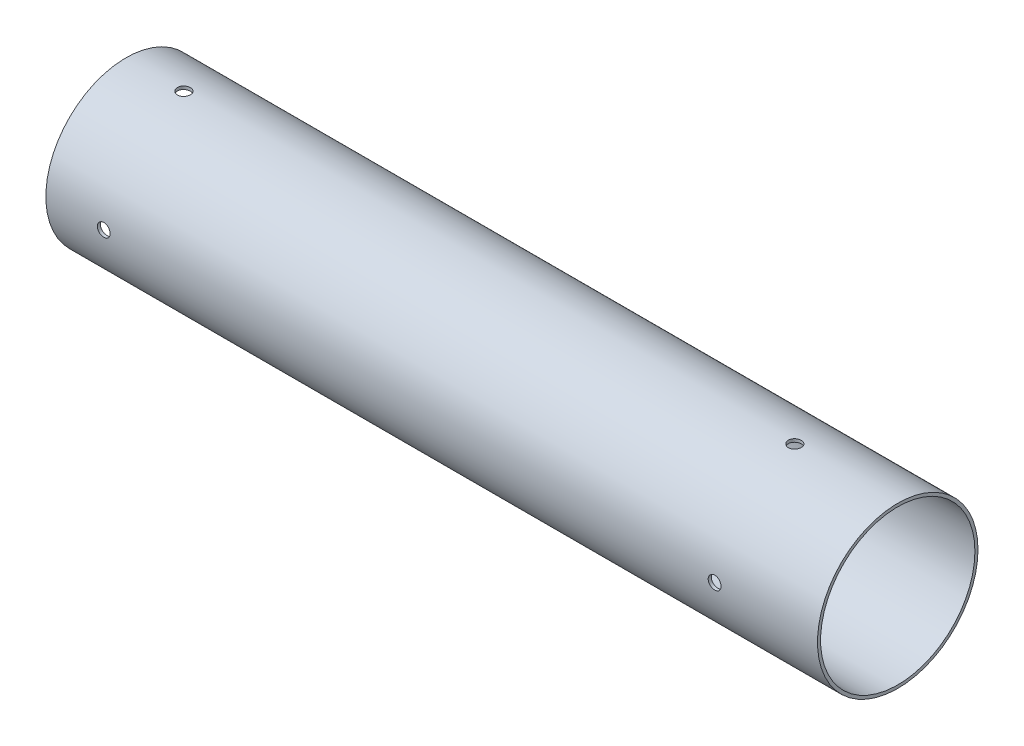
from build123d import *

# Parameters (mm, degrees)
SKETCH1_R           = 39.624
SKETCH1_R_2         = 38.1
BOSS_EXTRUDE1_DEPTH = 381
SKETCH2_R           = 3.175
CUT_EXTRUDE1_DEPTH  = 386.098848027
CIRPATTERN1_COUNT   = 4
SKETCH3_R           = 3.175
CUT_EXTRUDE2_DEPTH  = 386.098848147
CIRPATTERN2_COUNT   = 4


with BuildPart() as part:
    # Sketch1 → Boss-Extrude1 (new body)
    with BuildSketch(Plane.YZ):
        Circle(SKETCH1_R)
        Circle(SKETCH1_R_2, mode=Mode.SUBTRACT)
    extrude(amount=BOSS_EXTRUDE1_DEPTH)

    # Sketch2 → Cut-Extrude1 (cut, through all)
    with BuildSketch(Plane(origin=(0, 0, 0), x_dir=(-1, 0, 0), z_dir=(0, 1, 0))):
        with Locations((-330.2, 0)):
            Circle(SKETCH2_R)
    cut_extrude1 = extrude(amount=CUT_EXTRUDE1_DEPTH, mode=Mode.SUBTRACT)

    # CirPattern1: Cut-Extrude1 ×4 about axis
    cirpattern1_axis = Axis((381, 0, 0), (-1, 0, 0))
    for i in range(1, CIRPATTERN1_COUNT):
        add(cut_extrude1.rotate(cirpattern1_axis, i * 360 / CIRPATTERN1_COUNT), mode=Mode.SUBTRACT)

    # Sketch3 → Cut-Extrude2 (cut, through all)
    with BuildSketch(Plane(origin=(0, 0, 0), x_dir=(-1, 0, 0), z_dir=(0, 1, 0))):
        with Locations((-28.575, 0)):
            Circle(SKETCH3_R)
    cut_extrude2 = extrude(amount=CUT_EXTRUDE2_DEPTH, mode=Mode.SUBTRACT)

    # CirPattern2: Cut-Extrude2 ×4 about axis
    cirpattern2_axis = Axis((381, 0, 0), (-1, 0, 0))
    for i in range(1, CIRPATTERN2_COUNT):
        add(cut_extrude2.rotate(cirpattern2_axis, i * 360 / CIRPATTERN2_COUNT), mode=Mode.SUBTRACT)


solid = part.part
